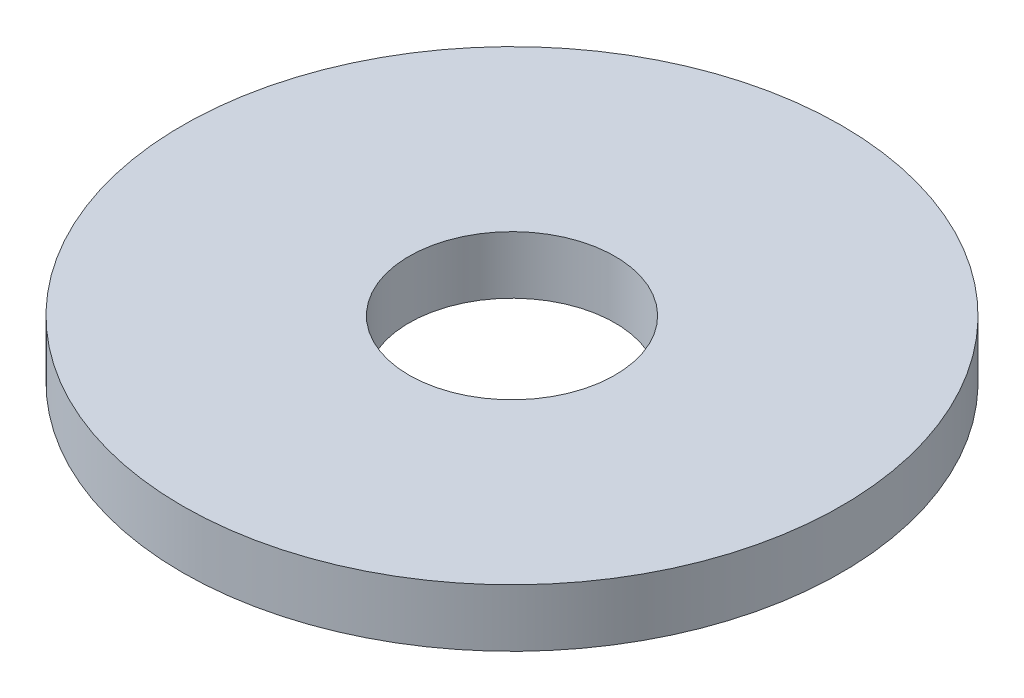
from build123d import *

# Parameters (mm, degrees)
SKETCH1_R           = 80
BOSS_EXTRUDE1_DEPTH = 14
SKETCH2_R           = 25
CUT_EXTRUDE1_DEPTH  = 115


with BuildPart() as part:
    # Sketch1 → Boss-Extrude1 (new body)
    with BuildSketch(Plane(origin=(0, 0, 0), x_dir=(1, 0, 0), z_dir=(0, 1, 0))):
        Circle(SKETCH1_R)
    extrude(amount=BOSS_EXTRUDE1_DEPTH)

    # Sketch2 → Cut-Extrude1 (cut, through all)
    with BuildSketch(Plane(origin=(0, 0, 0), x_dir=(1, 0, 0), z_dir=(0, 1, 0))):
        Circle(SKETCH2_R)
    extrude(amount=CUT_EXTRUDE1_DEPTH, mode=Mode.SUBTRACT)


solid = part.part
